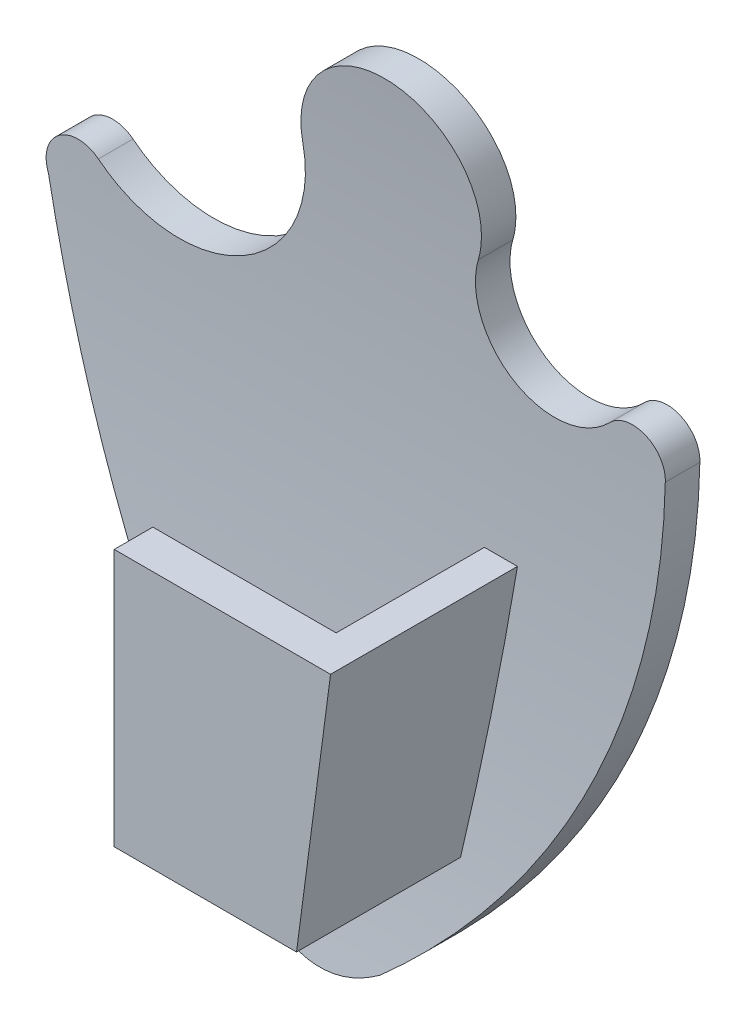
from build123d import *

# Parameters (mm, degrees)
SKETCH1_W               = 50
SKETCH1_H               = 90
BOSS_EXTRUDE1_DEPTH     = 20
CUT_EXTRUDE1_DEPTH      = 56.226805086
CUT_EXTRUDE1_DEPTH_BACK = 56.226805086
CUT_EXTRUDE3_DEPTH      = 56.226805249
CUT_EXTRUDE3_DEPTH_BACK = 56.226805249
SKETCH3_W               = 53.394951461
SKETCH3_H               = 97.469482402
CUT_EXTRUDE4_DEPTH      = 52.876845926
CUT_EXTRUDE4_DEPTH_BACK = 52.876845926
BOSS_EXTRUDE2_START     = 15
BOSS_EXTRUDE2_DEPTH     = 15
BOSS_EXTRUDE3_START     = 10
SKETCH6_W               = 3
SKETCH6_H               = 20
BOSS_EXTRUDE3_DEPTH     = 15
CUT_EXTRUDE5_START      = 20
CUT_EXTRUDE5_DEPTH      = 20


with BuildPart() as part:
    # Sketch1 → Boss-Extrude1 (new body)
    with BuildSketch(Plane.XY):
        Rectangle(SKETCH1_W, SKETCH1_H)
    extrude(amount=BOSS_EXTRUDE1_DEPTH)

    # Sketch2 → Cut-Extrude1 (cut, two sides: drawn at the far end of the back side and taken through both)
    with BuildSketch(Plane(origin=(0, 0, 0), x_dir=(0, 0, -1), z_dir=(1, 0, 0)).offset(-CUT_EXTRUDE1_DEPTH_BACK)):
        with BuildLine():
            Line((0, -45), (0, 45))
            Line((0, 45), (-17.5, 45))
            add(Edge.make_bspline(
                [(-17.5, 45), (-7.707630022, 0.402698665), (-17.5, -45)],
                knots=[0, 0, 0, 1, 1, 1], degree=2))
            Line((-17.5, -45), (0, -45))
        make_face()
        with BuildLine():
            add(Edge.make_bspline(
                [(-20, 45), (-10.579866715, 0.396123556), (-20, -45)],
                knots=[0, 0, 0, 1, 1, 1], degree=2))
            Line((-20, 45), (-20, -45))
        make_face()
    extrude(amount=CUT_EXTRUDE1_DEPTH + CUT_EXTRUDE1_DEPTH_BACK, mode=Mode.SUBTRACT)

    # Sketch3 → Cut-Extrude3 (cut, two sides: drawn at the far end of the back side and taken through both)
    with BuildSketch(Plane.XY.offset(-CUT_EXTRUDE3_DEPTH_BACK)):
        with Locations((-0.44957083, -0.81209815)):
            Rectangle(SKETCH3_W, SKETCH3_H)
        with BuildLine():
            ThreePointArc((4.407941876, -38.54256799), (0, -41.182472989), (-4.407941876, -38.54256799))
            add(Edge.make_bspline(
                [(-4.407941876, -38.54256799), (-20.370689218, -23.323081409), (-24.820857607, -0.929311555)],
                knots=[0, 0, 0, 0.979738208, 0.979738208, 0.979738208], degree=2))
            ThreePointArc((-24.820857607, -0.929311555), (-23.986903915, 2.009755395), (-20.932445196, 1.947504027))
            ThreePointArc((-20.932445196, 1.947504027), (-9.668517933, 1.07363701), (-4.778545173, 11.258324896))
            ThreePointArc((-4.778545173, 11.258324896), (2.711862012, 19.299492772), (8.792922221, 10.145953165))
            ThreePointArc((8.792922221, 10.145953165), (11.392518739, 3.144628342), (18.799551202, 4.099783531))
            ThreePointArc((18.799551202, 4.099783531), (21.59765723, 4.647249683), (23.088978941, 2.217213452))
            add(Edge.make_bspline(
                [(4.407941876, -38.54256799), (22.357036414, -22.883141582), (23.088978941, 2.217213452)],
                knots=[0, 0, 0, 0.997204383, 0.997204383, 0.997204383], degree=2))
        make_face(mode=Mode.SUBTRACT)
    extrude(amount=CUT_EXTRUDE3_DEPTH + CUT_EXTRUDE3_DEPTH_BACK, mode=Mode.SUBTRACT)

    # Sketch4 → Cut-Extrude4 (cut, two sides: drawn at the far end of the back side and taken through both)
    with BuildSketch(Plane.XY.offset(-CUT_EXTRUDE4_DEPTH_BACK)):
        with BuildLine():
            Line((4.407941876, -38.54256799), (7.834310742, -41.968936856))
            Line((7.834310742, -41.968936856), (-6.006562182, -43.289088611))
            Line((-6.006562182, -43.289088611), (-4.407941876, -38.54256799))
            add(Edge.make_bspline(
                [(-4.407941876, -38.54256799), (0, -41.606049712), (4.407941876, -38.54256799)],
                knots=[0, 0, 0, 1, 1, 1], degree=2))
        make_face()
    extrude(amount=CUT_EXTRUDE4_DEPTH + CUT_EXTRUDE4_DEPTH_BACK, mode=Mode.SUBTRACT)

    # Sketch5 → Boss-Extrude2 (add)
    with BuildSketch(Plane.XY.offset(BOSS_EXTRUDE2_START)):
        Polygon((9.230721099, -8.991124353), (6.586555281, -28.991124353), (9.153127559, -28.991124353), (11.797293378, -8.991124353), align=None)
    extrude(amount=BOSS_EXTRUDE2_DEPTH)

    # Sketch6 → Boss-Extrude3 (add)
    with BuildSketch(Plane(origin=(0, 0, 0), x_dir=(0, 0, -1), z_dir=(1, 0, 0)).offset(BOSS_EXTRUDE3_START)):
        with Locations((-28.5, -18.991124353)):
            Rectangle(SKETCH6_W, SKETCH6_H)
    extrude(amount=-BOSS_EXTRUDE3_DEPTH)

    # Sketch7 → Cut-Extrude5 (cut)
    with BuildSketch(Plane.XY.offset(CUT_EXTRUDE5_START)):
        Polygon((9.153127559, -28.991124353), (10.302921084, -20.294290615), (11.652021584, -29.321498861), align=None)
    extrude(amount=CUT_EXTRUDE5_DEPTH, mode=Mode.SUBTRACT)


solid = part.part
